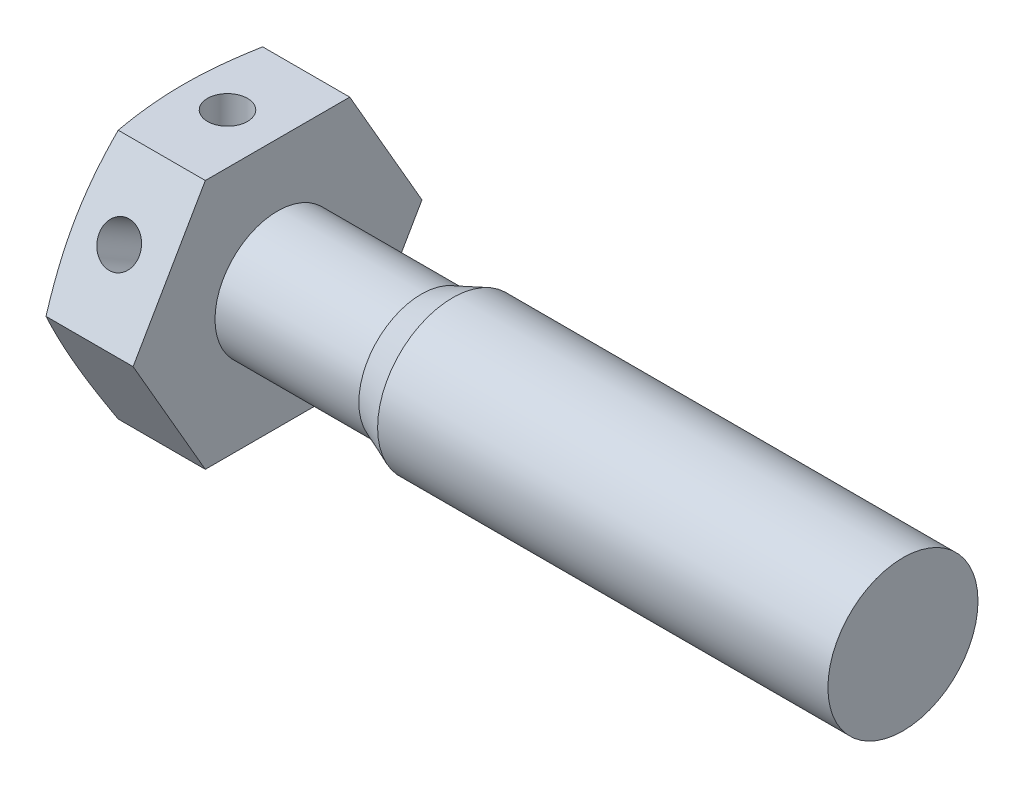
from build123d import *

# Parameters (mm, degrees)
BASEHEAD_DEPTH     = 4
SKETCH2_R          = 3
BASEBODY_DEPTH     = 25
SKETCH4_R          = 3.4
CUT_EXTRUDE1_DEPTH = 0.8
SKETCH6_R          = 0.8
HOLE_DEPTH         = 30.988886831
CIRPATTERN1_COUNT  = 2
CIRPATTERN1_ANGLE  = 60


with BuildPart() as part:
    # Sketch1 → BaseHead (new body)
    with BuildSketch(Plane(origin=(0, 0, 0), x_dir=(0, 0, -1), z_dir=(1, 0, 0))):
        Polygon((5.773502692, 0), (2.886751346, 5), (-2.886751346, 5), (-5.773502692, 0), (-2.886751346, -5), (2.886751346, -5), align=None)
    extrude(amount=BASEHEAD_DEPTH)

    # Sketch2 → BaseBody (add)
    with BuildSketch(Plane(origin=(4, 0, 0), x_dir=(0, 0, -1), z_dir=(1, 0, 0))):
        Circle(SKETCH2_R)
    extrude(amount=BASEBODY_DEPTH)

    # Sketch3 → HeadChamfer (revolve, cut)
    with BuildSketch(Plane(origin=(3.161211974, 0, 2.612290718), x_dir=(0, 0, -1), z_dir=(0, 1, 0))):
        Polygon((8.38579341, 3.161211974), (8.38579341, 2.643099366), (6.962290718, 3.161211974), align=None)
    revolve(axis=Axis((-2.071354488, 0, 0), (1, 0, 0)), mode=Mode.SUBTRACT)

    # Sketch4 → Cut-Extrude1 (cut)
    with BuildSketch(Plane.ZY):
        Circle(SKETCH4_R)
    extrude(amount=-CUT_EXTRUDE1_DEPTH, mode=Mode.SUBTRACT)

    # Sketch5 → Cut-Revolve1 (revolve, cut)
    with BuildSketch(Plane(origin=(-2.92963122, 0, 7.92963122), x_dir=(0, 0, -1), z_dir=(0, 1, 0))):
        Polygon((10.92963122, -13.92963122), (10.42963122, -12.67963122), (10.42963122, -6.92963122), (12.92963122, -6.92963122), (12.92963122, -13.92963122), align=None)
    revolve(axis=Axis((-2.697175707, 0, 0), (1, 0, 0)), mode=Mode.SUBTRACT)

    # Sketch6 → Hole (cut, symmetric)
    with BuildSketch(Plane(origin=(0, 0, 0), x_dir=(1, 0, 0), z_dir=(0, 1, 0))):
        with Locations((2, 0)):
            Circle(SKETCH6_R)
    hole = extrude(amount=HOLE_DEPTH, both=True, mode=Mode.SUBTRACT)

    # CirPattern1: Hole ×2 about axis
    cirpattern1_axis = Axis((-2.697175707, 0, 0), (1, 0, 0))
    for i in range(1, CIRPATTERN1_COUNT):
        add(hole.rotate(cirpattern1_axis, i * CIRPATTERN1_ANGLE / (CIRPATTERN1_COUNT - 1)), mode=Mode.SUBTRACT)


solid = part.part
